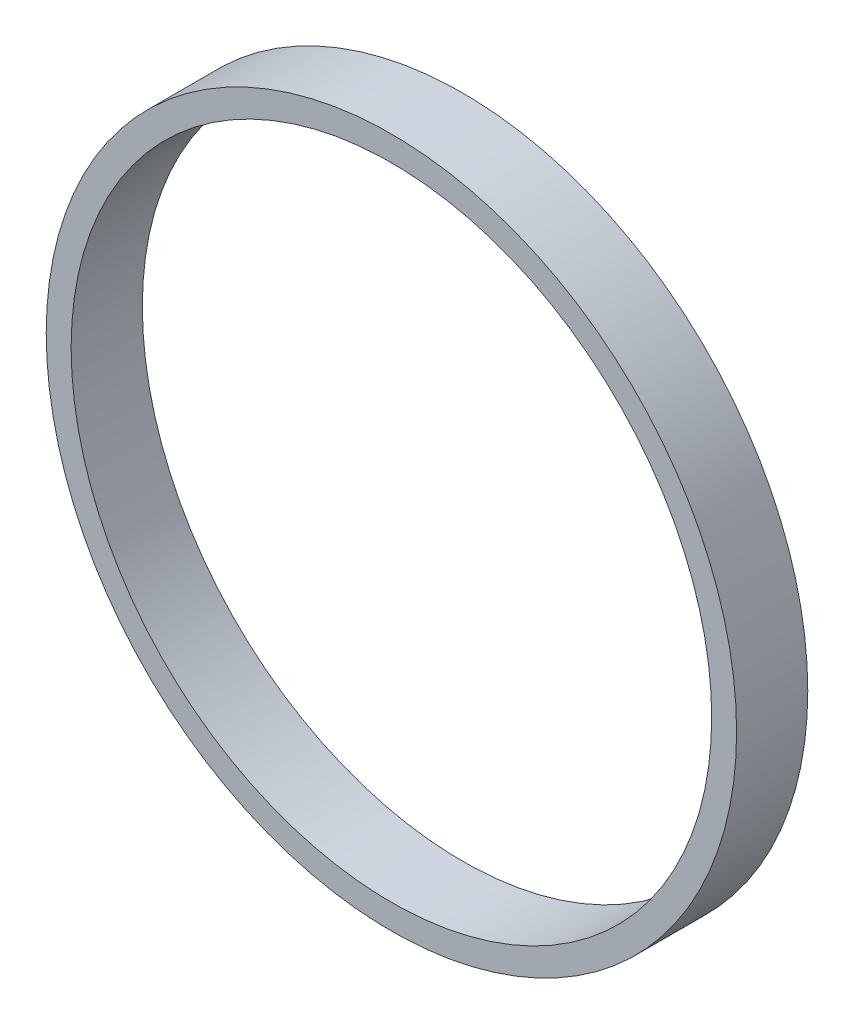
from build123d import *

# Parameters (mm, degrees)
SZKIC1_R                    = 48.5
SZKIC1_R_2                  = 45
DODANIE_WYCI_GNI_CIE1_DEPTH = 10


with BuildPart() as part:
    # Szkic1 → Dodanie-wyciągnięcie1 (new body)
    with BuildSketch(Plane.XY):
        Circle(SZKIC1_R)
        Circle(SZKIC1_R_2, mode=Mode.SUBTRACT)
    extrude(amount=DODANIE_WYCI_GNI_CIE1_DEPTH)


solid = part.part
